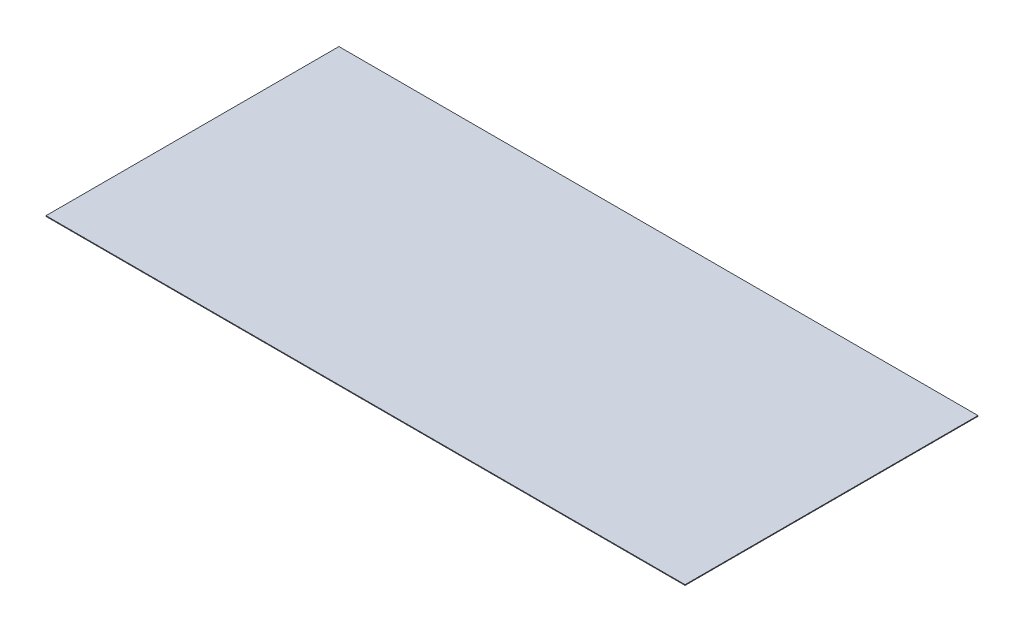
from build123d import *

# Parameters (mm, degrees)
SKETCH2_W           = 480
SKETCH2_H           = 220
BOSS_EXTRUDE1_DEPTH = 0.531


with BuildPart() as part:
    # Sketch2 → Boss-Extrude1 (new body)
    with BuildSketch(Plane(origin=(0, 0, 0), x_dir=(1, 0, 0), z_dir=(0, 1, 0))):
        Rectangle(SKETCH2_W, SKETCH2_H)
    extrude(amount=BOSS_EXTRUDE1_DEPTH)


solid = part.part
